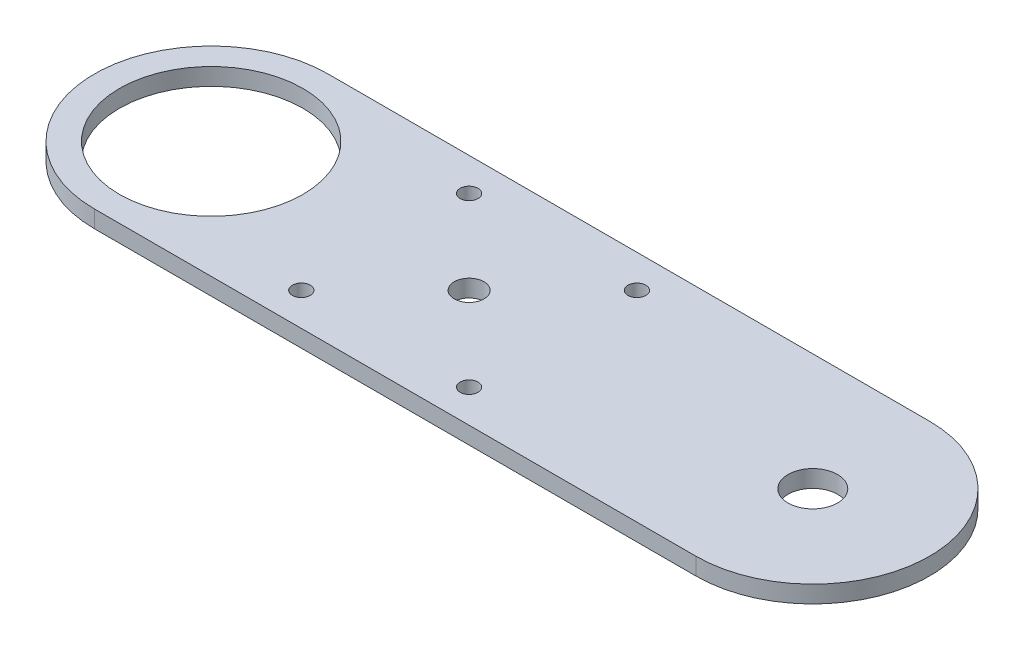
from build123d import *

# Parameters (mm, degrees)
SKETCH1_R           = 16.9545
SKETCH1_R_2         = 4.572
SKETCH1_R_3         = 2.75
SKETCH1_R_4         = 1.651
BOSS_EXTRUDE1_DEPTH = 3.175


with BuildPart() as part:
    # Sketch1 → Boss-Extrude1 (new body)
    with BuildSketch(Plane(origin=(0, 0, 0), x_dir=(1, 0, 0), z_dir=(0, 1, 0))):
        with BuildLine():
            Line((0, 21.59), (111.1504, 21.59))
            ThreePointArc((111.1504, 21.59), (132.7404, 0), (111.1504, -21.59))
            Line((111.1504, -21.59), (0, -21.59))
            ThreePointArc((0, -21.59), (-21.59, 0), (0, 21.59))
        make_face()
        Circle(SKETCH1_R, mode=Mode.SUBTRACT)
        with Locations((111.1504, 0)):
            Circle(SKETCH1_R_2, mode=Mode.SUBTRACT)
        with Locations((47.6504, 0)):
            Circle(SKETCH1_R_3, mode=Mode.SUBTRACT)
        with Locations((32.1504, -15.5)):
            Circle(SKETCH1_R_4, mode=Mode.SUBTRACT)
        with Locations((32.1504, 15.5)):
            Circle(SKETCH1_R_4, mode=Mode.SUBTRACT)
        with Locations((63.1504, 15.5)):
            Circle(SKETCH1_R_4, mode=Mode.SUBTRACT)
        with Locations((63.1504, -15.5)):
            Circle(SKETCH1_R_4, mode=Mode.SUBTRACT)
    extrude(amount=BOSS_EXTRUDE1_DEPTH)


solid = part.part
